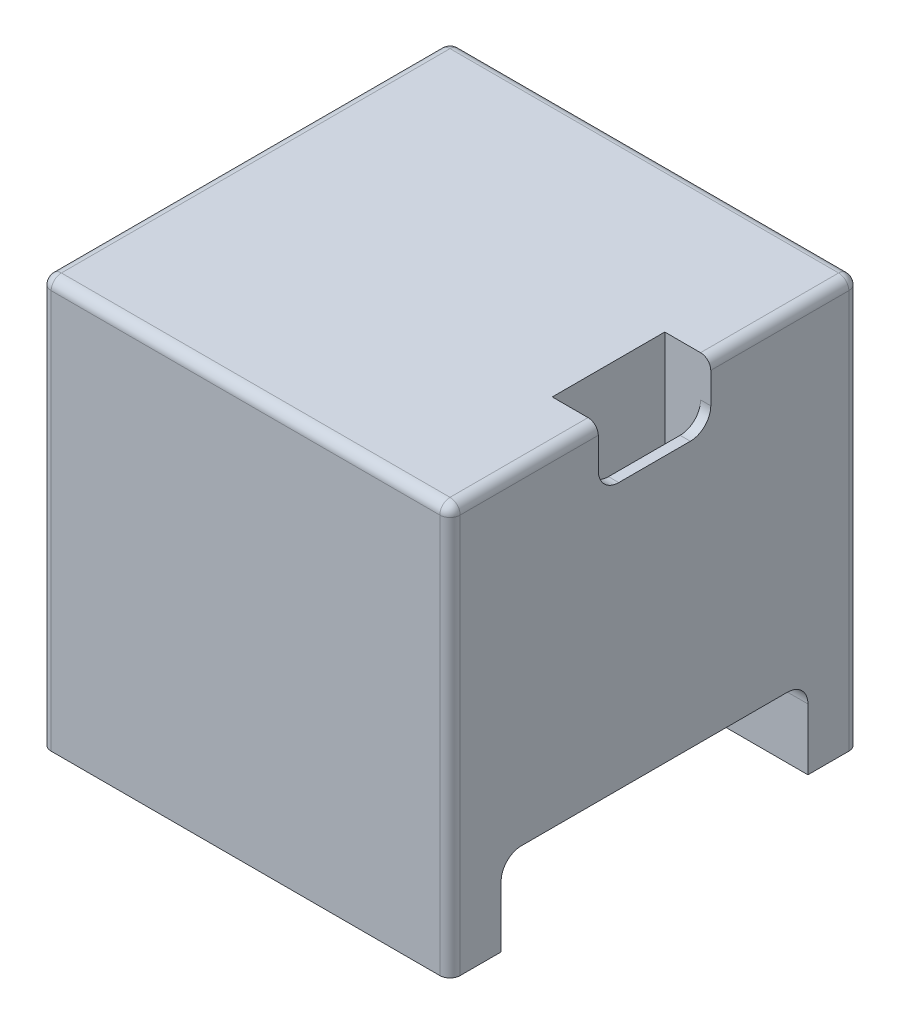
from build123d import *

# Parameters (mm, degrees)
SKETCH1_W           = 40
SKETCH1_H           = 40
BOSS_EXTRUDE1_DEPTH = 40
SKETCH2_W           = 40
SKETCH2_H           = 30
FORK_CUTOUT_DEPTH   = 8
SKETCH5_W           = 3.5
SKETCH5_H           = 11
CUT_EXTRUDE3_DEPTH  = 25
FILLET5_R           = 6
SKETCH6_W           = 1
SKETCH6_H           = 11
CUT_EXTRUDE4_DEPTH  = 6
FILLET6_R           = 2
FILLET8_R           = 2
SKETCH7_W           = 30
SKETCH7_H           = 30
BOSS_EXTRUDE2_DEPTH = 0.1
SKETCH10_W          = 3.75
SKETCH10_H          = 3.75
MARK38_DEPTH        = 0.1
FILLET9_R           = 1


with BuildPart() as part:
    # Sketch1 → Boss-Extrude1 (new body)
    with BuildSketch(Plane(origin=(0, 0, 0), x_dir=(1, 0, 0), z_dir=(0, 1, 0))):
        with Locations((20, 20)):
            Rectangle(SKETCH1_W, SKETCH1_H)
    extrude(amount=BOSS_EXTRUDE1_DEPTH)

    # Sketch2 → Fork Cutout (cut)
    with BuildSketch(Plane.XZ):
        with Locations((20, -20)):
            Rectangle(SKETCH2_W, SKETCH2_H)
    extrude(amount=-FORK_CUTOUT_DEPTH, mode=Mode.SUBTRACT)

    # Sketch5 → Cut-Extrude3 (cut)
    with BuildSketch(Plane(origin=(0, 40, 0), x_dir=(1, 0, 0), z_dir=(0, 1, 0))):
        with Locations((37.25, 20)):
            Rectangle(SKETCH5_W, SKETCH5_H)
    extrude(amount=-CUT_EXTRUDE3_DEPTH, mode=Mode.SUBTRACT)

    # Fillet5
    # the kernel refuses this fillet: 6 mm, written as the material it adds along each edge
    with BuildSketch(Plane(origin=(20.5, 15, -14.5), x_dir=(0, 1, 0), z_dir=(1, 0, 0)), Plane(origin=(39, 15, -25.5), x_dir=(0, 1, 0), z_dir=(-1, 0, 0))) as fillet5_piece_1:
        with BuildLine():
            CenterArc((FILLET5_R, -FILLET5_R), FILLET5_R, 90, 90)
            Line((0, -FILLET5_R), (0, 0))
            Line((0, 0), (FILLET5_R, 0))
        make_face()
    extrude(amount=18.5)

    # Sketch6 → Cut-Extrude4 (cut)
    with BuildSketch(Plane(origin=(0, 40, 0), x_dir=(1, 0, 0), z_dir=(0, 1, 0))):
        with Locations((39.5, 20)):
            Rectangle(SKETCH6_W, SKETCH6_H)
    extrude(amount=-CUT_EXTRUDE4_DEPTH, mode=Mode.SUBTRACT)

    # Fillet6
    fillet6_edges = [part.edges().sort_by_distance(p)[0] for p in [
        (39.5, 34, -25.5),
        (39.5, 34, -14.5),
    ]]
    fillet(fillet6_edges, radius=FILLET6_R)

    # Fillet8
    fillet8_edges = [part.edges().sort_by_distance(p)[0] for p in [
        (20, 8, -5),
        (20, 8, -35),
    ]]
    fillet(fillet8_edges, radius=FILLET8_R)

    # Sketch7 → Boss-Extrude2 (add)
    with BuildSketch(Plane.ZY):
        with Locations((-20, 23.75)):
            Rectangle(SKETCH7_W, SKETCH7_H)
    extrude(amount=BOSS_EXTRUDE2_DEPTH)

    # Sketch10 → Mark38 (cut)
    with BuildSketch(Plane.ZY.offset(0.1)):
        with Locations((-18.125, 33.125)):
            Rectangle(SKETCH10_W, SKETCH10_H)
        Polygon((-20, 27.5), (-12.5, 27.5), (-12.5, 20.128421558), (-16.25, 20.128421558), (-16.25, 16.25), (-20, 16.25), align=None)
        Polygon((-27.5, 35), (-23.75, 35), (-23.75, 16.071209331), (-28.076745998, 16.071209331), (-28.076745998, 12.5), (-31.25, 12.5), (-31.25, 30.980466229), (-27.5, 30.980466229), align=None)
    extrude(amount=-MARK38_DEPTH, mode=Mode.SUBTRACT)

    # Fillet9
    fillet9_edges = [part.edges().sort_by_distance(p)[0] for p in [
        (40, 40, -7.25),
        (20, 40, -40),
        (0, 40, -20),
        (40, 40, -32.75),
        (0, 20, -40),
        (40, 20, -40),
        (40, 20, 0),
        (0, 20, 0),
        (20, 40, 0),
    ]]
    fillet(fillet9_edges, radius=FILLET9_R)


solid = part.part
